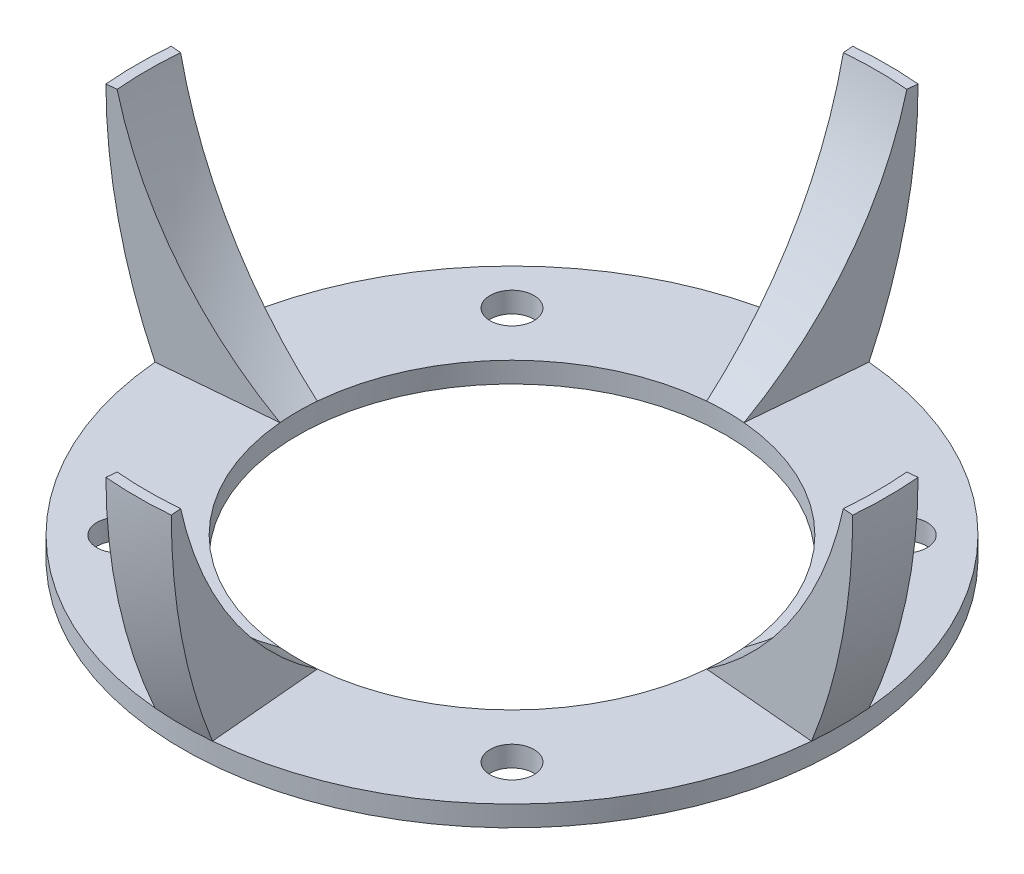
from build123d import *

# Parameters (mm, degrees)
SKETCH3_W               = 17.78
SKETCH3_H               = 3.175
REVOLVE2_ANGLE          = 10
CIRPATTERN1_COUNT       = 4
F_1_4_CLEARANCE_HOLE1_D = 6.7564
CIRPATTERN2_COUNT       = 4


# Read off the part's stored shape, not the designer's step: Revolve2
with BuildPart() as part:
    # Sketch3 → Revolve1 (revolve)
    with BuildSketch(Plane.XY, mode=Mode.PRIVATE) as revolve1_sk:
        with Locations((-41.91, 1.5875)):
            Rectangle(SKETCH3_W, SKETCH3_H)
    revolve(revolve1_sk.sketch.rotate(Axis((0, -0.15875, 0), (0, 1, 0)), 270), axis=Axis((0, -0.15875, 0), (0, 1, 0)))

    # Revolve2 outline → Revolve2 (revolve)
    with BuildSketch(Plane(origin=(0, 0, 0), x_dir=(-0.9961946980917455, 0, -0.0871557427476582), z_dir=(0.0871557427476582, 0, -0.9961946980917455))):
        with BuildLine():
            Line((33.02, 3.175), (50.8, 3.175))
            ThreePointArc((50.8, 3.175), (56.020671736, 19.804496878), (57.785, 37.144702343))
            Line((57.785, 37.144702343), (56.1975, 37.144702343))
            ThreePointArc((56.1975, 37.144702343), (47.732858136, 18.028274757), (33.02, 3.175))
        make_face()
    revolve2 = revolve(axis=Axis((0, 0, 0), (0, 1, 0)), revolution_arc=REVOLVE2_ANGLE)

    # CirPattern1: Revolve2 ×4 about axis
    cirpattern1_axis = Axis((0, -0.15875, 0), (0, 1, 0))
    for i in range(1, CIRPATTERN1_COUNT):
        add(revolve2.rotate(cirpattern1_axis, i * 360 / CIRPATTERN1_COUNT))

    # 1/4 Clearance Hole1 (through all)
    with Locations(Plane(origin=(0, 3.175, 0), x_dir=(1, 0, 0), z_dir=(0, 1, 0))):
        with Locations((-30.308364409, -30.308364409)):
            f_1_4_clearance_hole1 = Hole(F_1_4_CLEARANCE_HOLE1_D / 2)

    # CirPattern2: 1/4 Clearance Hole1 ×4 about axis
    cirpattern2_axis = Axis((0, 0, 0), (0, 1, 0))
    for i in range(1, CIRPATTERN2_COUNT):
        add(f_1_4_clearance_hole1.rotate(cirpattern2_axis, i * 360 / CIRPATTERN2_COUNT), mode=Mode.SUBTRACT)


solid = part.part
